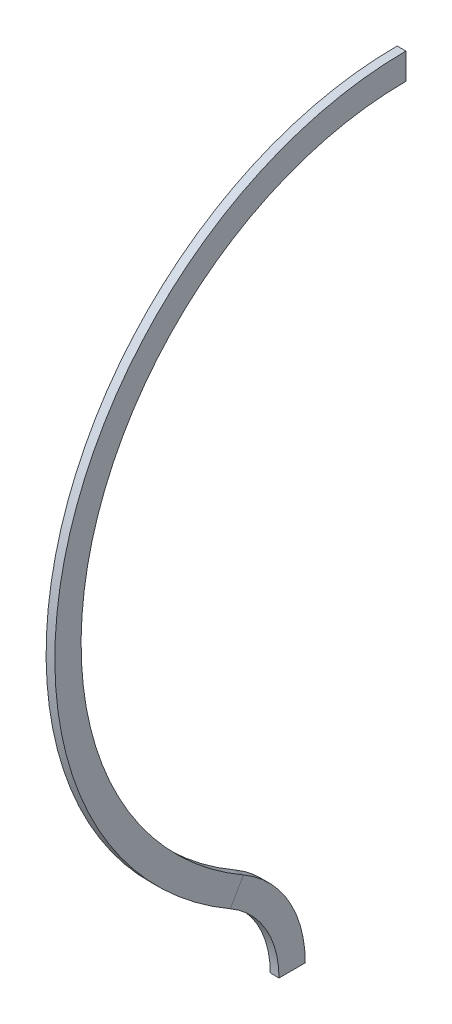
from build123d import *

# Parameters (mm, degrees)
SKETCH2_W = 2
SKETCH2_H = 6


with BuildPart() as part:
    # Sweep1: sweep along a path in Sketch1
    with BuildLine(Plane(origin=(0, 0, 0), x_dir=(0, 0, -1), z_dir=(1, 0, 0))) as sweep1_path:
        ThreePointArc((0, 163), (-71.713768688, 107.972089876), (-37.121778265, 24.459637448))
        ThreePointArc((-37.121778265, 24.459637448), (-26.783919082, 14.121778265), (-23, 0))
    # Sketch2 → Sweep1 (sweep)
    with BuildSketch(Plane(origin=(0, 0, 0), x_dir=(1, 0, 0), z_dir=(0, 1, 0))):
        with Locations((1, -26)):
            Rectangle(SKETCH2_W, SKETCH2_H)
    sweep(path=sweep1_path.line)


solid = part.part
